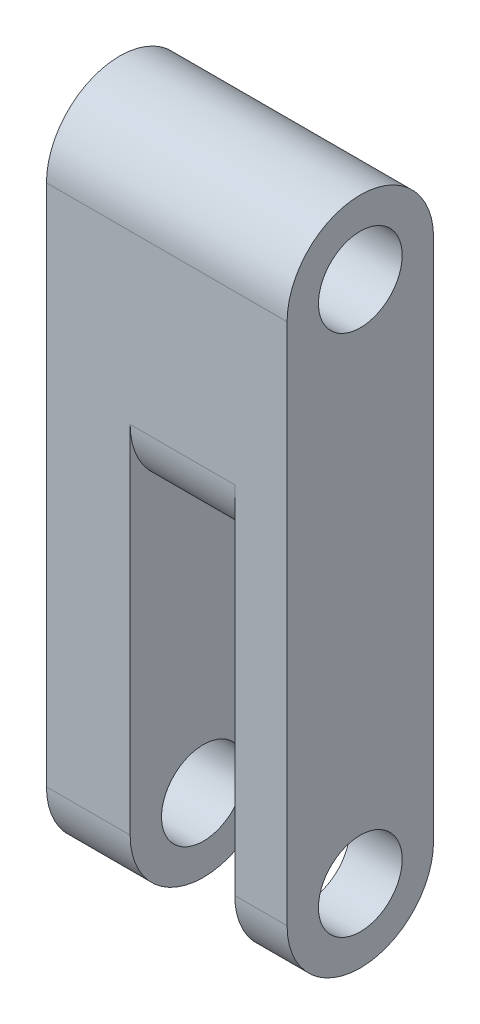
from build123d import *

# Parameters (mm, degrees)
EXTRUDE_1_DEPTH     = 11.5
SKETCH_2_R          = 2
CUT_EXTRUDE_2_DEPTH = 15
CUT_EXTRUDE_3_DEPTH = 5


with BuildPart() as part:
    # Эскиз1 → Бобышка-Вытянуть1 (new body)
    with BuildSketch(Plane(origin=(0, 0, 0), x_dir=(0, 0, -1), z_dir=(1, 0, 0))):
        with BuildLine():
            Line((0, 0), (0, 25))
            ThreePointArc((0, 25), (3.5, 28.5), (7, 25))
            Line((7, 25), (7, 0))
            ThreePointArc((7, 0), (3.5, -3.5), (0, 0))
        make_face()
    extrude(amount=EXTRUDE_1_DEPTH)

    # Эскиз2 → Вырез-Вытянуть2 (cut)
    with BuildSketch(Plane(origin=(11.5, 0, 0), x_dir=(0, 0, -1), z_dir=(1, 0, 0))):
        with Locations((3.5, 25)):
            Circle(SKETCH_2_R)
        with Locations((3.5, 0)):
            Circle(SKETCH_2_R)
    extrude(amount=-CUT_EXTRUDE_2_DEPTH, mode=Mode.SUBTRACT)

    # Эскиз3 → Вырез-Вытянуть3 (cut)
    with BuildSketch(Plane(origin=(4, 0, 0), x_dir=(0, 0, -1), z_dir=(1, 0, 0))):
        with BuildLine():
            Line((-5.973465406, 17), (-5.973465406, -6.207481123))
            Line((-5.973465406, -6.207481123), (11.9268428, -6.207481123))
            Line((11.9268428, -6.207481123), (11.9268428, 17))
            Line((11.9268428, 17), (7, 17))
            ThreePointArc((7, 17), (3.5, 13.5), (0, 17))
            Line((0, 17), (-5.973465406, 17))
        make_face()
    extrude(amount=CUT_EXTRUDE_3_DEPTH, mode=Mode.SUBTRACT)


solid = part.part
